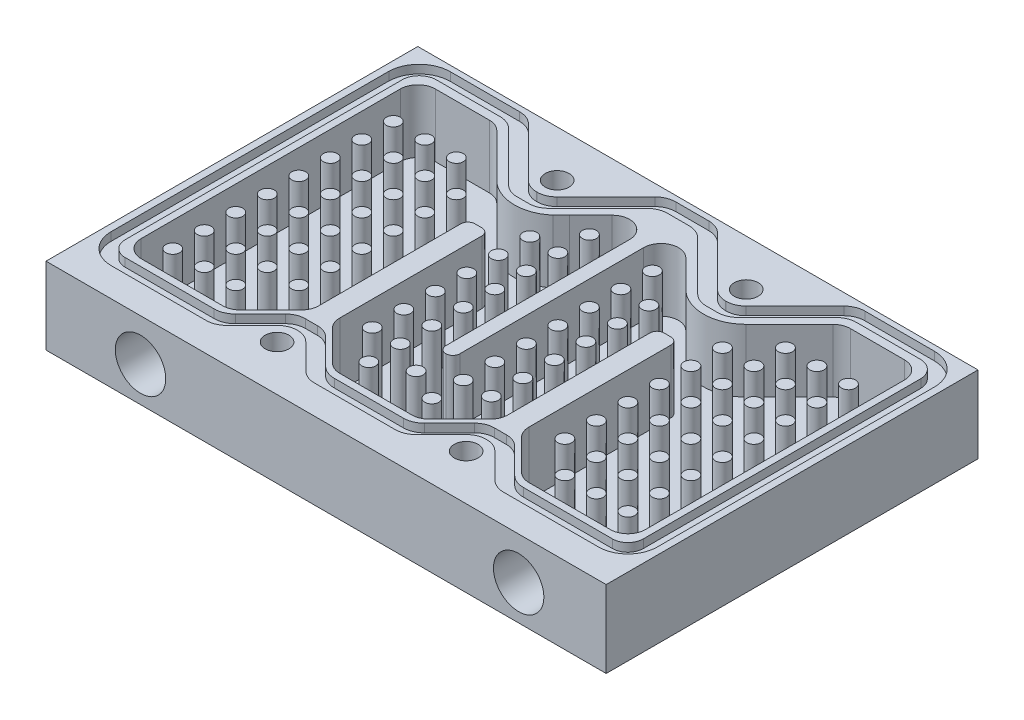
from build123d import *

# Parameters (mm, degrees)
SKIZZE1_W                       = 80
SKIZZE1_H                       = 50
AUFSATZ_LINEAR_AUSTRAGEN1_DEPTH = 11
DURCHGANGSLOCH_F_R_M31_D        = 3.4
SCHNITT_LINEAR_AUSTRAGEN1_DEPTH = 9
SKIZZE7_W                       = 3
SKIZZE7_H                       = 26.379507135
SKIZZE7_H_2                     = 26.550526096
SKIZZE7_W_2                     = 2
SKIZZE7_H_3                     = 32
AUFSATZ_LINEAR_AUSTRAGEN2_DEPTH = 9
SKIZZE10_R                      = 1
AUFSATZ_LINEAR_AUSTRAGEN3_DEPTH = 9
VERRUNDUNG1_R                   = 2.5
VERRUNDUNG2_R                   = 1
LINEARES_MUSTER1_COUNT          = 2
LINEARES_MUSTER1_PITCH          = 51.5
SKIZZE11_R                      = 1
AUFSATZ_LINEAR_AUSTRAGEN4_DEPTH = 9
AUFSATZ_LINEAR_AUSTRAGEN5_REACH = 96.979
VERRUNDUNG3_R                   = 2.5
SCHNITT_LINEAR_START            = -1.2
SCHNITT_LINEAR_AUSTRAGEN2_DEPTH = 1.2
AUFSATZ_LINEAR_AUSTRAGEN7_DEPTH = 9
SPIEGELN1_START                 = 9.8
SPIEGELN1_DEPTH                 = 1.2
SCHNITT_LINEAR_START_2          = -9
SKIZZE15_R                      = 1.067100039
SKIZZE15_R_2                    = 1.115829795
SCHNITT_LINEAR_AUSTRAGEN3_DEPTH = 9
SKIZZE16_R                      = 1
AUFSATZ_LINEAR_AUSTRAGEN6_DEPTH = 9
SCHNITT_LINEAR_AUSTRAGEN4_DEPTH = 1.2
LINEARES_MUSTER2_COUNT          = 2
LINEARES_MUSTER2_PITCH          = 27
VERRUNDUNG4_R                   = 2.5
VERRUNDUNG5_R                   = 2.5
SCHNITT_LINEAR_AUSTRAGEN5_DEPTH = 1.2
SCHNITT_LINEAR_AUSTRAGEN6_DEPTH = 9
VERRUNDUNG6_R                   = 2.5
SKIZZE26_W                      = 80
SKIZZE26_H                      = 11
AUFSATZ_LINEAR_AUSTRAGEN8_DEPTH = 3.1
M8X0_75_GEWINDEBOHRUNG1_D       = 7.2
M8X0_75_GEWINDEBOHRUNG1_DEPTH   = 7.1


with BuildPart() as part:
    # Skizze1 → Aufsatz-Linear austragen1 (new body)
    with BuildSketch(Plane(origin=(0, 0, 0), x_dir=(1, 0, 0), z_dir=(0, 1, 0))):
        with Locations((40, 25)):
            Rectangle(SKIZZE1_W, SKIZZE1_H)
    extrude(amount=AUFSATZ_LINEAR_AUSTRAGEN1_DEPTH)

    # Durchgangsloch für M31 (through all)
    with Locations(Plane(origin=(0, 11, 0), x_dir=(1, 0, 0), z_dir=(0, 1, 0))):
        with Locations((26.5, 3.4), (53.5, 3.4), (53.5, 43.4), (26.5, 43.4)):
            Hole(DURCHGANGSLOCH_F_R_M31_D / 2)

    # Skizze6 → Schnitt-Linear austragen1 (cut)
    with BuildSketch(Plane(origin=(0, 11, 0), x_dir=(1, 0, 0), z_dir=(0, 1, 0))):
        with BuildLine():
            Line((24.55, 46), (4, 46))
            Line((4, 46), (4, 4))
            Line((4, 4), (23.305864749, 4))
            ThreePointArc((23.305864749, 4), (26.5, 6.65), (29.694135251, 4))
            Line((29.694135251, 4), (50.305864749, 4))
            ThreePointArc((50.305864749, 4), (53.5, 6.65), (56.694135251, 4))
            Line((56.694135251, 4), (76, 4))
            Line((76, 4), (76, 46))
            Line((76, 46), (55.45, 46))
            ThreePointArc((55.45, 46), (56.406888371, 44.853444185), (56.75, 43.4))
            ThreePointArc((56.75, 43.4), (52.046555815, 40.493111629), (51.55, 46))
            Line((51.55, 46), (28.45, 46))
            ThreePointArc((28.45, 46), (29.406888371, 44.853444185), (29.75, 43.4))
            ThreePointArc((29.75, 43.4), (25.046555815, 40.493111629), (24.55, 46))
        make_face()
    extrude(amount=-SCHNITT_LINEAR_AUSTRAGEN1_DEPTH, mode=Mode.SUBTRACT)

    # Skizze7 → Aufsatz-Linear austragen2 (add)
    with BuildSketch(Plane(origin=(0, 2, 0), x_dir=(1, 0, 0), z_dir=(0, 1, 0))):
        with Locations((26.5, 18.960246432)):
            Rectangle(SKIZZE7_W, SKIZZE7_H)
        with Locations((53.5, 18.874736952)):
            Rectangle(SKIZZE7_W, SKIZZE7_H_2)
        with Locations((40, 30)):
            Rectangle(SKIZZE7_W_2, SKIZZE7_H_3)
    extrude(amount=AUFSATZ_LINEAR_AUSTRAGEN2_DEPTH)

    # Skizze10 → Aufsatz-Linear austragen3 (add)
    with BuildSketch(Plane(origin=(0, 2, 0), x_dir=(1, 0, 0), z_dir=(0, 1, 0))):
        with Locations(Location((72.5, 7.5, 0), (0, 0, 270))):
            Circle(SKIZZE10_R)
        with Locations(Location((68, 7.5, 0), (0, 0, 270))):
            Circle(SKIZZE10_R)
        with Locations(Location((63.5, 7.5, 0), (0, 0, 270))):
            Circle(SKIZZE10_R)
        with Locations(Location((59, 7.5, 0), (0, 0, 270))):
            Circle(SKIZZE10_R)
        with Locations(Location((68, 12, 0), (0, 0, 270))):
            Circle(SKIZZE10_R)
        with Locations(Location((63.5, 12, 0), (0, 0, 270))):
            Circle(SKIZZE10_R)
        with Locations(Location((59, 12, 0), (0, 0, 270))):
            Circle(SKIZZE10_R)
        with Locations(Location((68, 16.5, 0), (0, 0, 270))):
            Circle(SKIZZE10_R)
        with Locations(Location((63.5, 16.5, 0), (0, 0, 270))):
            Circle(SKIZZE10_R)
        with Locations(Location((59, 16.5, 0), (0, 0, 270))):
            Circle(SKIZZE10_R)
        with Locations(Location((68, 21, 0), (0, 0, 270))):
            Circle(SKIZZE10_R)
        with Locations(Location((63.5, 21, 0), (0, 0, 270))):
            Circle(SKIZZE10_R)
        with Locations(Location((59, 21, 0), (0, 0, 270))):
            Circle(SKIZZE10_R)
        with Locations(Location((68, 25.5, 0), (0, 0, 270))):
            Circle(SKIZZE10_R)
        with Locations(Location((63.5, 25.5, 0), (0, 0, 270))):
            Circle(SKIZZE10_R)
        with Locations(Location((59, 25.5, 0), (0, 0, 270))):
            Circle(SKIZZE10_R)
        with Locations(Location((68, 30, 0), (0, 0, 270))):
            Circle(SKIZZE10_R)
        with Locations(Location((63.5, 30, 0), (0, 0, 270))):
            Circle(SKIZZE10_R)
        with Locations(Location((59, 30, 0), (0, 0, 270))):
            Circle(SKIZZE10_R)
        with Locations(Location((68, 34.5, 0), (0, 0, 270))):
            Circle(SKIZZE10_R)
        with Locations(Location((63.5, 34.5, 0), (0, 0, 270))):
            Circle(SKIZZE10_R)
        with Locations(Location((59, 34.5, 0), (0, 0, 270))):
            Circle(SKIZZE10_R)
        with Locations(Location((68, 39, 0), (0, 0, 270))):
            Circle(SKIZZE10_R)
        with Locations(Location((63.5, 39, 0), (0, 0, 270))):
            Circle(SKIZZE10_R)
        with Locations(Location((59, 39, 0), (0, 0, 270))):
            Circle(SKIZZE10_R)
        with Locations(Location((72.5, 12, 0), (0, 0, 270))):
            Circle(SKIZZE10_R)
        with Locations(Location((72.5, 16.5, 0), (0, 0, 270))):
            Circle(SKIZZE10_R)
        with Locations(Location((72.5, 21, 0), (0, 0, 270))):
            Circle(SKIZZE10_R)
        with Locations(Location((72.5, 25.5, 0), (0, 0, 270))):
            Circle(SKIZZE10_R)
        with Locations(Location((72.5, 30, 0), (0, 0, 270))):
            Circle(SKIZZE10_R)
        with Locations(Location((72.5, 34.5, 0), (0, 0, 270))):
            Circle(SKIZZE10_R)
        with Locations(Location((72.5, 39, 0), (0, 0, 270))):
            Circle(SKIZZE10_R)
    aufsatz_linear_austragen3 = extrude(amount=AUFSATZ_LINEAR_AUSTRAGEN3_DEPTH)

    # Verrundung1
    verrundung1_edges = [part.edges().sort_by_distance(p)[0] for p in [
        (39, 6.5, -46),
        (41, 6.5, -46),
        (29.694135251, 6.5, -4),
        (23.305864749, 6.5, -4),
        (4, 6.5, -4),
        (4, 6.5, -46),
        (24.55, 6.5, -46),
        (28.45, 6.5, -46),
        (51.55, 6.5, -46),
        (55.45, 6.5, -46),
        (76, 6.5, -46),
        (76, 6.5, -4),
        (56.694135251, 6.5, -4),
        (50.305864749, 6.5, -4),
        (25, 6.5, -6.283140649),
        (28, 6.5, -6.283140649),
        (55, 6.5, -6.283140649),
        (52, 6.5, -6.283140649),
    ]]
    fillet(verrundung1_edges, radius=VERRUNDUNG1_R)

    # Verrundung2
    verrundung2_edges = [part.edges().sort_by_distance(p)[0] for p in [
        (39, 6.5, -14),
        (41, 6.5, -14),
        (25, 6.5, -32.15),
        (28, 6.5, -32.15),
        (52, 6.5, -32.15),
        (55, 6.5, -32.15),
    ]]
    fillet(verrundung2_edges, radius=VERRUNDUNG2_R - 0.0001)  # a hair under: the kernel refuses the full size

    # Lineares Muster1: Aufsatz-Linear austragen3 ×2
    with Locations(*[(-i * LINEARES_MUSTER1_PITCH, 0, 0) for i in range(1, LINEARES_MUSTER1_COUNT)]):
        add(aufsatz_linear_austragen3)

    # Skizze11 → Aufsatz-Linear austragen4 (add)
    with BuildSketch(Plane(origin=(0, 2, 0), x_dir=(1, 0, 0), z_dir=(0, 1, 0))):
        with Locations(Location((31.5, 7.5, 0), (0, 0, 270))):
            Circle(SKIZZE11_R)
        with Locations(Location((35.5, 7.5, 0), (0, 0, 270))):
            Circle(SKIZZE11_R)
        with Locations(Location((31.5, 12, 0), (0, 0, 270))):
            Circle(SKIZZE11_R)
        with Locations(Location((35.5, 12, 0), (0, 0, 270))):
            Circle(SKIZZE11_R)
        with Locations(Location((31.5, 16.5, 0), (0, 0, 270))):
            Circle(SKIZZE11_R)
        with Locations(Location((35.5, 16.5, 0), (0, 0, 270))):
            Circle(SKIZZE11_R)
        with Locations(Location((31.5, 21, 0), (0, 0, 270))):
            Circle(SKIZZE11_R)
        with Locations(Location((35.5, 21, 0), (0, 0, 270))):
            Circle(SKIZZE11_R)
        with Locations(Location((31.5, 25.5, 0), (0, 0, 270))):
            Circle(SKIZZE11_R)
        with Locations(Location((35.5, 25.5, 0), (0, 0, 270))):
            Circle(SKIZZE11_R)
        with Locations(Location((31.5, 30, 0), (0, 0, 270))):
            Circle(SKIZZE11_R)
        with Locations(Location((35.5, 30, 0), (0, 0, 270))):
            Circle(SKIZZE11_R)
        with Locations(Location((31.5, 34.5, 0), (0, 0, 270))):
            Circle(SKIZZE11_R)
        with Locations(Location((35.5, 34.5, 0), (0, 0, 270))):
            Circle(SKIZZE11_R)
        with Locations(Location((31.5, 39, 0), (0, 0, 270))):
            Circle(SKIZZE11_R)
        with Locations(Location((35.5, 39, 0), (0, 0, 270))):
            Circle(SKIZZE11_R)
        with Locations(Location((44.5, 7.5, 0), (0, 0, 270))):
            Circle(SKIZZE11_R)
        with Locations(Location((48.5, 7.5, 0), (0, 0, 270))):
            Circle(SKIZZE11_R)
        with Locations(Location((44.5, 12, 0), (0, 0, 270))):
            Circle(SKIZZE11_R)
        with Locations(Location((48.5, 12, 0), (0, 0, 270))):
            Circle(SKIZZE11_R)
        with Locations(Location((44.5, 16.5, 0), (0, 0, 270))):
            Circle(SKIZZE11_R)
        with Locations(Location((48.5, 16.5, 0), (0, 0, 270))):
            Circle(SKIZZE11_R)
        with Locations(Location((44.5, 21, 0), (0, 0, 270))):
            Circle(SKIZZE11_R)
        with Locations(Location((48.5, 21, 0), (0, 0, 270))):
            Circle(SKIZZE11_R)
        with Locations(Location((44.5, 25.5, 0), (0, 0, 270))):
            Circle(SKIZZE11_R)
        with Locations(Location((48.5, 25.5, 0), (0, 0, 270))):
            Circle(SKIZZE11_R)
        with Locations(Location((44.5, 30, 0), (0, 0, 270))):
            Circle(SKIZZE11_R)
        with Locations(Location((48.5, 30, 0), (0, 0, 270))):
            Circle(SKIZZE11_R)
        with Locations(Location((44.5, 34.5, 0), (0, 0, 270))):
            Circle(SKIZZE11_R)
        with Locations(Location((48.5, 34.5, 0), (0, 0, 270))):
            Circle(SKIZZE11_R)
        with Locations(Location((44.5, 39, 0), (0, 0, 270))):
            Circle(SKIZZE11_R)
        with Locations(Location((48.5, 39, 0), (0, 0, 270))):
            Circle(SKIZZE11_R)
        with Locations(Location((40, 9.75, 0), (0, 0, 270))):
            Circle(SKIZZE11_R)
    extrude(amount=AUFSATZ_LINEAR_AUSTRAGEN4_DEPTH)

    # Skizze14 → Aufsatz-Linear austragen5 (add, up to next)
    with BuildSketch(Plane(origin=(0, 11, 0), x_dir=(1, 0, 0), z_dir=(0, 1, 0)), mode=Mode.PRIVATE) as aufsatz_linear_austragen5_sk1:
        Polygon((52, 9.819595949), (46.180404051, 4), (51.502045222, 4), (52, 5.097786363), align=None)
    aufsatz_linear_austragen5_tool1 = extrude(aufsatz_linear_austragen5_sk1.sketch, amount=-AUFSATZ_LINEAR_AUSTRAGEN5_REACH, mode=Mode.PRIVATE) - part.part
    # Skizze14 → Aufsatz-Linear austragen5 (add, up to next)
    with BuildSketch(Plane(origin=(0, 11, 0), x_dir=(1, 0, 0), z_dir=(0, 1, 0)), mode=Mode.PRIVATE) as aufsatz_linear_austragen5_sk2:
        Polygon((55, 9.819595949), (60.819595949, 4), (55.815123611, 4), (55, 5.097786363), align=None)
    aufsatz_linear_austragen5_tool2 = extrude(aufsatz_linear_austragen5_sk2.sketch, amount=-AUFSATZ_LINEAR_AUSTRAGEN5_REACH, mode=Mode.PRIVATE) - part.part
    # Skizze14 → Aufsatz-Linear austragen5 (add, up to next)
    with BuildSketch(Plane(origin=(0, 11, 0), x_dir=(1, 0, 0), z_dir=(0, 1, 0)), mode=Mode.PRIVATE) as aufsatz_linear_austragen5_sk3:
        Polygon((28, 9.819595949), (33.819595949, 4), (29.493008219, 4), (28, 5.493008219), align=None)
    aufsatz_linear_austragen5_tool3 = extrude(aufsatz_linear_austragen5_sk3.sketch, amount=-AUFSATZ_LINEAR_AUSTRAGEN5_REACH, mode=Mode.PRIVATE) - part.part
    # Skizze14 → Aufsatz-Linear austragen5 (add, up to next)
    with BuildSketch(Plane(origin=(0, 11, 0), x_dir=(1, 0, 0), z_dir=(0, 1, 0)), mode=Mode.PRIVATE) as aufsatz_linear_austragen5_sk4:
        Polygon((25, 9.819595949), (19.180404051, 4), (23.788367089, 4), (25, 5.211632911), align=None)
    aufsatz_linear_austragen5_tool4 = extrude(aufsatz_linear_austragen5_sk4.sketch, amount=-AUFSATZ_LINEAR_AUSTRAGEN5_REACH, mode=Mode.PRIVATE) - part.part
    add(aufsatz_linear_austragen5_tool1.solids().sort_by_distance((50.031033, 11, -5.965687))[0])
    add(aufsatz_linear_austragen5_tool2.solids().sort_by_distance((56.985136, 11, -5.982579))[0])
    add(aufsatz_linear_austragen5_tool3.solids().sort_by_distance((30.041474, 11, -6.041474))[0])
    add(aufsatz_linear_austragen5_tool4.solids().sort_by_distance((22.990538, 11, -6.009462))[0])

    # Verrundung3
    verrundung3_edges = [part.edges().sort_by_distance(p)[0] for p in [
        (46.180404051, 6.5, -4),
        (52, 6.5, -9.819595949),
        (55, 6.5, -9.819595949),
        (60.819595949, 6.5, -4),
        (28, 6.5, -9.819595949),
        (33.819595949, 6.5, -4),
        (19.180404051, 6.5, -4),
        (25, 6.5, -9.819595949),
    ]]
    fillet(verrundung3_edges, radius=VERRUNDUNG3_R)

    # Schnitt-Linear austragen2: read off the stored shape, not the designer's step
    # Schnitt-Linear austragen2 outline → Schnitt-Linear austragen2 (cut)
    with BuildSketch(Plane(origin=(0, 11, 0), x_dir=(1, 0, 0), z_dir=(0, 1, 0)).offset(SCHNITT_LINEAR_START)):
        with BuildLine():
            Line((62.522539674, 48.321320344), (60.201219331, 46))
            Line((60.201219331, 46), (63.029646456, 46))
            Line((63.029646456, 46), (63.350966799, 46.321320344))
            ThreePointArc((63.350966799, 46.321320344), (64.324236846, 46.971638598), (65.472287143, 47.2))
            Line((65.472287143, 47.2), (74.556772282, 47.2))
            ThreePointArc((74.556772282, 47.2), (76.237850875, 46.531173307), (77, 44.890294552))
            Line((77, 44.890294552), (77, 5.2))
            ThreePointArc((77, 5.2), (76.355634919, 3.644365081), (74.8, 3))
            Line((74.8, 3), (62.073419186, 3.000084449))
            ThreePointArc((62.073419186, 3.000084449), (60.924714499, 3.228212944), (59.950882596, 3.878763859))
            Line((59.950882596, 3.878763859), (56.349747468, 7.479898987))
            ThreePointArc((56.349747468, 7.479898987), (55.441362092, 8.086862691), (54.369848481, 8.3))
            Line((54.369848481, 8.3), (52.630151519, 8.3))
            ThreePointArc((52.630151519, 8.3), (51.558637908, 8.086862691), (50.650252532, 7.479898987))
            Line((50.650252532, 7.479898987), (47.049033201, 3.878679656))
            ThreePointArc((47.049033201, 3.878679656), (46.075763154, 3.228361402), (44.927712857, 3))
            Line((44.927712857, 3), (40, 3))
            Line((40, 3), (40, 1))
            Line((40, 1), (45.756139982, 1))
            ThreePointArc((45.756139982, 1), (46.904190279, 1.228361402), (47.877460326, 1.878679656))
            Line((47.877460326, 1.878679656), (51.478679656, 5.479898987))
            ThreePointArc((51.478679656, 5.479898987), (52.387065033, 6.086862691), (53.458578644, 6.3))
            Line((53.458578644, 6.3), (53.541421356, 6.3))
            ThreePointArc((53.541421356, 6.3), (54.612934967, 6.086862691), (55.521320344, 5.479898987))
            Line((55.521320344, 5.479898987), (59.122480181, 1.87873915))
            ThreePointArc((59.122480181, 1.87873915), (60.095617562, 1.228475852), (61.243513329, 1.000059507))
            Line((61.243513329, 1.000059507), (61.865118668, 1))
            Line((61.865118668, 1), (74.8, 1))
            ThreePointArc((74.8, 1), (77.769848481, 2.230151519), (79, 5.2))
            Line((79, 5.2), (79, 44.890294552))
            ThreePointArc((79, 44.890294552), (77.651761522, 47.945581366), (74.556772282, 49.2))
            Line((74.556772282, 49.2), (64.643860018, 49.2))
            ThreePointArc((64.643860018, 49.2), (63.495809721, 48.971638598), (62.522539674, 48.321320344))
        make_face()
        with BuildLine():
            Line((56.588034361, 42.386815031), (55.521320344, 41.320101013))
            ThreePointArc((55.521320344, 41.320101013), (54.612934967, 40.713137309), (53.541421356, 40.5))
            Line((53.541421356, 40.5), (53.458578644, 40.5))
            ThreePointArc((53.458578644, 40.5), (52.387065033, 40.713137309), (51.478679656, 41.320101013))
            Line((51.478679656, 41.320101013), (50.411965639, 42.386815031))
            ThreePointArc((50.411965639, 42.386815031), (53.5, 40.15), (56.588034361, 42.386815031))
        make_face()
        with BuildLine():
            Line((42.356139982, 49.2), (40, 49.2))
            Line((40, 49.2), (40, 47.2))
            Line((40, 47.2), (41.527712857, 47.2))
            ThreePointArc((41.527712857, 47.2), (42.675763154, 46.971638598), (43.649033201, 46.321320344))
            Line((43.649033201, 46.321320344), (43.970353544, 46))
            Line((43.970353544, 46), (46.798780669, 46))
            Line((46.798780669, 46), (44.477460326, 48.321320344))
            ThreePointArc((44.477460326, 48.321320344), (43.504190279, 48.971638598), (42.356139982, 49.2))
        make_face()
    extrude(amount=SCHNITT_LINEAR_AUSTRAGEN2_DEPTH, mode=Mode.SUBTRACT)

    # Skizze18 → Aufsatz-Linear austragen7 (add)
    with BuildSketch(Plane(origin=(0, 11, 0), x_dir=(1, 0, 0), z_dir=(0, 1, 0))):
        with BuildLine():
            Line((57.813351365, 39.086648635), (64.72670273, 46))
            Line((64.72670273, 46), (57.101287778, 46))
            Line((57.101287778, 46), (55.940671953, 43.5))
            ThreePointArc((55.940671953, 43.5), (55.942207717, 43.450010482), (55.94271971, 43.4))
            ThreePointArc((55.94271971, 43.4), (53.571561839, 40.958328752), (51.061473237, 43.256937752))
            Line((51.061473237, 43.256937752), (50.523058886, 46))
            Line((50.523058886, 46), (47.750869631, 46))
            Line((47.750869631, 46), (43.5, 46))
            ThreePointArc((43.5, 46), (42.982546401, 45.945862174), (42.487503852, 45.785793418))
            Line((42.487503852, 45.785793418), (49.186648635, 39.086648635))
            ThreePointArc((49.186648635, 39.086648635), (53.5, 37.3), (57.813351365, 39.086648635))
        make_face()
    aufsatz_linear_austragen7 = extrude(amount=-AUFSATZ_LINEAR_AUSTRAGEN7_DEPTH)

    # Spiegeln1: read off the stored shape, not the designer's step
    # Spiegeln1 outline → Spiegeln1 (cut)
    with BuildSketch(Plane(origin=(0, 0, 0), x_dir=(1, 0, 0), z_dir=(0, 1, 0)).offset(SPIEGELN1_START)):
        with BuildLine():
            Line((26.458578644, 6.3), (26.541421356, 6.3))
            ThreePointArc((26.541421356, 6.3), (27.612934967, 6.086862691), (28.521320344, 5.479898987))
            Line((28.521320344, 5.479898987), (32.122539674, 1.878679656))
            ThreePointArc((32.122539674, 1.878679656), (33.095809721, 1.228361402), (34.243860018, 1))
            Line((34.243860018, 1), (40, 1))
            Line((40, 1), (40, 3))
            Line((40, 3), (35.072287143, 3))
            ThreePointArc((35.072287143, 3), (33.924236846, 3.228361402), (32.950966799, 3.878679656))
            Line((32.950966799, 3.878679656), (29.349747468, 7.479898987))
            ThreePointArc((29.349747468, 7.479898987), (28.441362092, 8.086862691), (27.369848481, 8.3))
            Line((27.369848481, 8.3), (25.630151519, 8.3))
            ThreePointArc((25.630151519, 8.3), (24.558637908, 8.086862691), (23.650252532, 7.479898987))
            Line((23.650252532, 7.479898987), (20.049117404, 3.878763859))
            ThreePointArc((20.049117404, 3.878763859), (19.075285501, 3.228212944), (17.926580814, 3.000084449))
            Line((17.926580814, 3.000084449), (5.2, 3))
            ThreePointArc((5.2, 3), (3.644365081, 3.644365081), (3, 5.2))
            Line((3, 5.2), (3, 44.890294552))
            ThreePointArc((3, 44.890294552), (3.762149125, 46.531173307), (5.443227718, 47.2))
            Line((5.443227718, 47.2), (14.527712857, 47.2))
            ThreePointArc((14.527712857, 47.2), (15.675763154, 46.971638598), (16.649033201, 46.321320344))
            Line((16.649033201, 46.321320344), (16.970353544, 46))
            Line((16.970353544, 46), (19.798780669, 46))
            Line((19.798780669, 46), (17.477460326, 48.321320344))
            ThreePointArc((17.477460326, 48.321320344), (16.504190279, 48.971638598), (15.356139982, 49.2))
            Line((15.356139982, 49.2), (5.443227718, 49.2))
            ThreePointArc((5.443227718, 49.2), (2.348238478, 47.945581366), (1, 44.890294552))
            Line((1, 44.890294552), (1, 5.2))
            ThreePointArc((1, 5.2), (2.230151519, 2.230151519), (5.2, 1))
            Line((5.2, 1), (18.134881332, 1))
            Line((18.134881332, 1), (18.756486671, 1.000059507))
            ThreePointArc((18.756486671, 1.000059507), (19.904382438, 1.228475852), (20.877519819, 1.87873915))
            Line((20.877519819, 1.87873915), (24.478679656, 5.479898987))
            ThreePointArc((24.478679656, 5.479898987), (25.387065033, 6.086862691), (26.458578644, 6.3))
        make_face()
        with BuildLine():
            Line((40, 49.2), (37.643860018, 49.2))
            ThreePointArc((37.643860018, 49.2), (36.495809721, 48.971638598), (35.522539674, 48.321320344))
            Line((35.522539674, 48.321320344), (33.201219331, 46))
            Line((33.201219331, 46), (36.029646456, 46))
            Line((36.029646456, 46), (36.350966799, 46.321320344))
            ThreePointArc((36.350966799, 46.321320344), (37.324236846, 46.971638598), (38.472287143, 47.2))
            Line((38.472287143, 47.2), (40, 47.2))
            Line((40, 47.2), (40, 49.2))
        make_face()
        with BuildLine():
            Line((29.588034361, 42.386815031), (28.521320344, 41.320101013))
            ThreePointArc((28.521320344, 41.320101013), (27.612934967, 40.713137309), (26.541421356, 40.5))
            Line((26.541421356, 40.5), (26.458578644, 40.5))
            ThreePointArc((26.458578644, 40.5), (25.387065033, 40.713137309), (24.478679656, 41.320101013))
            Line((24.478679656, 41.320101013), (23.411965639, 42.386815031))
            ThreePointArc((23.411965639, 42.386815031), (26.5, 40.15), (29.588034361, 42.386815031))
        make_face()
    extrude(amount=SPIEGELN1_DEPTH, mode=Mode.SUBTRACT)

    # Skizze15 → Schnitt-Linear austragen3 (cut)
    with BuildSketch(Plane(origin=(0, 11, 0), x_dir=(1, 0, 0), z_dir=(0, 1, 0)).offset(SCHNITT_LINEAR_START_2)):
        with Locations((21, 7.5)):
            Circle(SKIZZE15_R)
        with Locations((59, 7.5)):
            Circle(SKIZZE15_R_2)
        with BuildLine():
            Line((30.520360471, 7.299235478), (31.299235478, 6.520360471))
            ThreePointArc((31.299235478, 6.520360471), (32.207106781, 8.207106781), (30.520360471, 7.299235478))
        make_face()
        with BuildLine():
            Line((48.700764522, 6.520360471), (49.479639529, 7.299235478))
            ThreePointArc((49.479639529, 7.299235478), (47.792893219, 8.207106781), (48.700764522, 6.520360471))
        make_face()
    extrude(amount=SCHNITT_LINEAR_AUSTRAGEN3_DEPTH, mode=Mode.SUBTRACT)

    # Skizze16 → Aufsatz-Linear austragen6 (add)
    with BuildSketch(Plane(origin=(0, 2, 0), x_dir=(1, 0, 0), z_dir=(0, 1, 0))):
        with Locations(Location((26.5, 36.75, 0), (0, 0, 270))):
            Circle(SKIZZE16_R)
        with Locations((53.5, 36.75)):
            Circle(SKIZZE16_R)
    extrude(amount=AUFSATZ_LINEAR_AUSTRAGEN6_DEPTH)

    # Skizze13<4> → Schnitt-Linear austragen4 (cut)
    with BuildSketch(Plane(origin=(0, 11, 0), x_dir=(1, 0, 0), z_dir=(0, 1, 0)).offset(SCHNITT_LINEAR_START)):
        with BuildLine():
            Line((43.649033201, 46.321320344), (50.591673888, 39.378679656))
            ThreePointArc((50.591673888, 39.378679656), (51.564943934, 38.728361402), (52.712994231, 38.5))
            Line((52.712994231, 38.5), (54.287005769, 38.5))
            ThreePointArc((54.287005769, 38.5), (55.435056066, 38.728361402), (56.408326112, 39.378679656))
            Line((56.408326112, 39.378679656), (63.350966799, 46.321320344))
            ThreePointArc((63.350966799, 46.321320344), (64.324236846, 46.971638598), (65.472287143, 47.2))
            Line((65.472287143, 47.2), (74.556772282, 47.2))
            Line((74.556772282, 47.2), (74.556772282, 49.2))
            Line((74.556772282, 49.2), (64.643860018, 49.2))
            ThreePointArc((64.643860018, 49.2), (63.495809721, 48.971638598), (62.522539674, 48.321320344))
            Line((62.522539674, 48.321320344), (55.521320344, 41.320101013))
            ThreePointArc((55.521320344, 41.320101013), (54.612934967, 40.713137309), (53.541421356, 40.5))
            Line((53.541421356, 40.5), (53.458578644, 40.5))
            ThreePointArc((53.458578644, 40.5), (52.387065033, 40.713137309), (51.478679656, 41.320101013))
            Line((51.478679656, 41.320101013), (44.477460326, 48.321320344))
            ThreePointArc((44.477460326, 48.321320344), (43.504190279, 48.971638598), (42.356139982, 49.2))
            Line((42.356139982, 49.2), (40, 49.2))
            Line((40, 49.2), (40, 47.2))
            Line((40, 47.2), (41.527712857, 47.2))
            ThreePointArc((41.527712857, 47.2), (42.675763154, 46.971638598), (43.649033201, 46.321320344))
        make_face()
    extrude(amount=SCHNITT_LINEAR_AUSTRAGEN4_DEPTH, mode=Mode.SUBTRACT)

    # Lineares Muster2: Aufsatz-Linear austragen7 ×2
    with Locations(*[(-i * LINEARES_MUSTER2_PITCH, 0, 0) for i in range(1, LINEARES_MUSTER2_COUNT)]):
        add(aufsatz_linear_austragen7)

    # Verrundung4
    # the kernel refuses this fillet: 2.5 mm, written as the material it adds along each edge
    with BuildSketch(Plane(origin=(16.5, 11, -46), x_dir=(-0.9783448694535777, 0, 0.206981439781111), z_dir=(0, -1, 0))) as verrundung4_piece_1_section:
        with BuildLine():
            CenterArc((2.498594424, -2.026726352), VERRUNDUNG4_R, 101.945515298, 23.891030597)
            Line((1.981140824, 0.419135821), (0, 0))
            ThreePointArc((0, 0), (0.517453599, 0.054137826), (1.034907199, 0))
        make_face()
    verrundung4_piece_1 = extrude(amount=14.062480742, mode=Mode.PRIVATE)
    verrundung4_piece_1 = split(verrundung4_piece_1, bisect_by=Plane(origin=(16.5, 0, -46), z_dir=(0, 1, 0)), keep=Keep.TOP, mode=Mode.PRIVATE)
    add(verrundung4_piece_1)
    with BuildSketch(Plane(origin=(37.512496148, -9.962766477, -45.785793418), x_dir=(0.3108611738148868, 0, 0.9504553280477894), z_dir=(0, 1, 0))) as verrundung4_piece_2_section:
        with BuildLine():
            CenterArc((4.007953656, -2.37613832), VERRUNDUNG4_R, 71.888863521, 135)
            Line((1.778240027, -3.506791729), (1.555268664, -3.61985707))
            Line((1.555268664, -3.61985707), (-0.222971363, -0.113065341))
            Line((-0.222971363, -0.113065341), (-0.185779879, 0.167289678))
            ThreePointArc((-0.185779879, 0.167289678), (2.71266702, 0.940855368), (4.862821884, 0.237613832))
            Line((4.862821884, 0.237613832), (4.785106591, 0))
        make_face()
    verrundung4_piece_2 = extrude(amount=20.962766477, mode=Mode.PRIVATE)
    verrundung4_piece_2 = split(verrundung4_piece_2, bisect_by=Plane(origin=(37.512496148, 0, -45.785793418), z_dir=(0, 1, 0)), keep=Keep.TOP, mode=Mode.PRIVATE)
    add(verrundung4_piece_2)
    with BuildSketch(Plane(origin=(42.487503852, 11, -45.785793418), x_dir=(0.7071067811865476, 0, 0.7071067811865476), z_dir=(0, -1, 0))) as verrundung4_piece_3_section:
        with BuildLine():
            CenterArc((3.931885785, 2.5), VERRUNDUNG4_R, 135, 135)
            Line((2.164118832, 4.267766953), (1.987342137, 4.444543648))
            ThreePointArc((1.987342137, 4.444543648), (0.38769927, 2.844900782), (-0.233224292, -0.090035713))
            Line((-0.233224292, -0.090035713), (0, -0.25))
            Line((0, -0.25), (3.931885785, -0.25))
            Line((3.931885785, -0.25), (3.931885785, 0))
        make_face()
    verrundung4_piece_3 = extrude(amount=20.962766477, mode=Mode.PRIVATE)
    verrundung4_piece_3 = split(verrundung4_piece_3, bisect_by=Plane(origin=(42.487503852, 0, -45.785793418), z_dir=(0, 1, 0)), keep=Keep.TOP, mode=Mode.PRIVATE)
    add(verrundung4_piece_3)

    # Verrundung5
    # the kernel refuses this fillet: 2.5 mm, written as the material it adds along each edge
    with BuildSketch(Plane(origin=(15.487503852, 11, -45.785793418), x_dir=(-0.9856268046559793, 0, -0.16893727221558938), z_dir=(0, -1, 0))) as verrundung5_piece_1_section:
        with BuildLine():
            CenterArc((0.845622019, -2.464067012), VERRUNDUNG5_R, 80.273964425, 45)
            Line((-0.598094747, -0.423066791), (-0.742466424, -0.218966769))
            Line((-0.742466424, -0.218966769), (-0.144371677, 0.204100022))
            Line((-0.144371677, 0.204100022), (-0.061178764, 0.24239876))
            ThreePointArc((-0.061178764, 0.24239876), (1.076365137, 0.286486113), (1.310199518, 0.246406701))
            Line((1.310199518, 0.246406701), (1.2679652, 0))
        make_face()
    verrundung5_piece_1 = extrude(amount=12.169912999, mode=Mode.PRIVATE)
    verrundung5_piece_1 = split(verrundung5_piece_1, bisect_by=Plane(origin=(15.487503852, 0, -45.785793418), z_dir=(0, 1, 0)), keep=Keep.TOP, mode=Mode.PRIVATE)
    add(verrundung5_piece_1)

    # Skizze19 → Schnitt-Linear austragen5 (cut)
    with BuildSketch(Plane(origin=(0, 11, 0), x_dir=(1, 0, 0), z_dir=(0, 1, 0))):
        with BuildLine():
            Line((19.798780669, 46), (24.478679656, 41.320101013))
            ThreePointArc((24.478679656, 41.320101013), (25.387065033, 40.713137309), (26.458578644, 40.5))
            Line((26.458578644, 40.5), (26.541421356, 40.5))
            ThreePointArc((26.541421356, 40.5), (27.612934967, 40.713137309), (28.521320344, 41.320101013))
            Line((28.521320344, 41.320101013), (33.201219331, 46))
            Line((33.201219331, 46), (36.029646456, 46))
            Line((36.029646456, 46), (29.349747468, 39.320101013))
            ThreePointArc((29.349747468, 39.320101013), (28.441362092, 38.713137309), (27.369848481, 38.5))
            Line((27.369848481, 38.5), (25.630151519, 38.5))
            ThreePointArc((25.630151519, 38.5), (24.558637908, 38.713137309), (23.650252532, 39.320101013))
            Line((23.650252532, 39.320101013), (16.970353544, 46))
            Line((16.970353544, 46), (19.798780669, 46))
        make_face()
    extrude(amount=-SCHNITT_LINEAR_AUSTRAGEN5_DEPTH, mode=Mode.SUBTRACT)

    # Skizze20 → Schnitt-Linear austragen6 (cut)
    with BuildSketch(Plane(origin=(0, 11, 0), x_dir=(1, 0, 0), z_dir=(0, 1, 0)).offset(SCHNITT_LINEAR_START_2)):
        with BuildLine():
            Line((21.328949893, 39.944347377), (21.944347377, 39.328949893))
            ThreePointArc((21.944347377, 39.328949893), (20.292893219, 38.292893219), (21.328949893, 39.944347377))
        make_face()
        with BuildLine():
            Line((31.705384163, 39.978681432), (30.518140998, 38.810387498))
            ThreePointArc((30.518140998, 38.810387498), (32.201395732, 38.287227928), (31.705384163, 39.978681432))
        make_face()
        with BuildLine():
            Line((48.294615837, 39.978681432), (49.481859002, 38.810387498))
            ThreePointArc((49.481859002, 38.810387498), (47.798604268, 38.287227928), (48.294615837, 39.978681432))
        make_face()
        with BuildLine():
            Line((58.055652623, 39.328949893), (58.671050107, 39.944347377))
            ThreePointArc((58.671050107, 39.944347377), (59.707106781, 38.292893219), (58.055652623, 39.328949893))
        make_face()
        with BuildLine():
            ThreePointArc((25.701838551, 37.352443609), (26.5, 35.75), (27.298161449, 37.352443609))
            ThreePointArc((27.298161449, 37.352443609), (26.5, 37.3), (25.701838551, 37.352443609))
        make_face()
        with BuildLine():
            ThreePointArc((52.701838551, 37.352443609), (53.5, 35.75), (54.298161449, 37.352443609))
            ThreePointArc((54.298161449, 37.352443609), (53.5, 37.3), (52.701838551, 37.352443609))
        make_face()
    extrude(amount=SCHNITT_LINEAR_AUSTRAGEN6_DEPTH, mode=Mode.SUBTRACT)

    # Verrundung6
    verrundung6_edges = [part.edges().sort_by_distance(p)[0] for p in [
        (64.72670273, 6.5, -46),
    ]]
    fillet(verrundung6_edges, radius=VERRUNDUNG6_R)

    # Skizze26 → Aufsatz-Linear austragen8 (add)
    with BuildSketch(Plane.XY):
        with Locations((40, 5.5)):
            Rectangle(SKIZZE26_W, SKIZZE26_H)
    extrude(amount=AUFSATZ_LINEAR_AUSTRAGEN8_DEPTH)

    # M8x0.75 Gewindebohrung1
    with Locations(Plane.XY.offset(3.1)):
        with Locations((13.5, 5), (67.5, 5)):
            Hole(M8X0_75_GEWINDEBOHRUNG1_D / 2, depth=M8X0_75_GEWINDEBOHRUNG1_DEPTH)


solid = part.part
